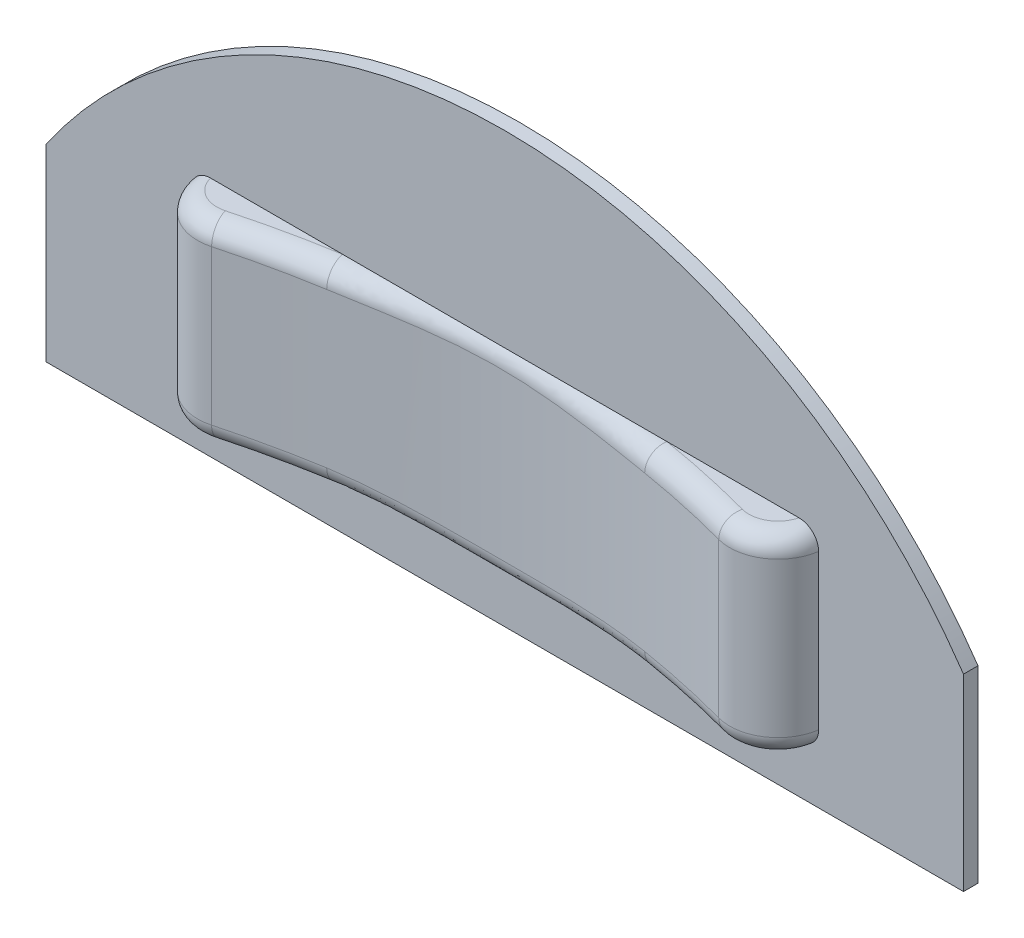
from build123d import *

# Parameters (mm, degrees)
BOSS_EXTRUDE1_DEPTH = 3
SKETCH2_W           = 130
SKETCH2_H           = 40
BOSS_EXTRUDE2_DEPTH = 12
CUT_EXTRUDE1_REACH  = 199.041
FILLET1_R           = 10
FILLET2_R           = 4


with BuildPart() as part:
    # Sketch1 → Boss-Extrude1 (new body)
    with BuildSketch(Plane.XY):
        with BuildLine():
            Line((190, 0), (190, -39))
            Line((190, -39), (0, -39))
            Line((0, -39), (0, 0))
            ThreePointArc((0, 0), (95, 50), (190, 0))
        make_face()
    extrude(amount=BOSS_EXTRUDE1_DEPTH)

    # Sketch2 → Boss-Extrude2 (add)
    with BuildSketch(Plane.XY.offset(3)):
        with Locations((95, -9)):
            Rectangle(SKETCH2_W, SKETCH2_H)
    extrude(amount=BOSS_EXTRUDE2_DEPTH)

    # Sketch3 → Cut-Extrude1 (cut, up to next)
    with BuildSketch(Plane(origin=(0, 11, 0), x_dir=(1, 0, 0), z_dir=(0, 1, 0)), mode=Mode.PRIVATE) as cut_extrude1_sk1:
        with BuildLine():
            Line((30, -15), (160, -15))
            ThreePointArc((160, -15), (95, -4.241357564), (30, -15))
        make_face()
    cut_extrude1_tool1 = extrude(cut_extrude1_sk1.sketch, amount=-CUT_EXTRUDE1_REACH, mode=Mode.PRIVATE) & part.part
    add(cut_extrude1_tool1.solids().sort_by_distance((95, 11, 10.686553))[0], mode=Mode.SUBTRACT)

    # Fillet1
    # the kernel refuses this fillet: 10 mm, written as the material it takes off along each edge
    with BuildSketch(Plane(origin=(160, 43.655354589, 15), x_dir=(0, 0, -1), z_dir=(0, -1, 0)), Plane(origin=(30, -61.655354589, 15), x_dir=(0, 0, -1), z_dir=(0, 1, 0))) as fillet1_piece_1:
        with BuildLine():
            CenterArc((13.461551545, -9.892616796), FILLET1_R, 98.40417735, 96.681797386)
            Line((3.806187845, -12.495298453), (3.613080571, -12.547352086))
            ThreePointArc((3.613080571, -12.547352086), (1.812932851, -6.275113154), (-0.189333785, -0.064441584))
            Line((-0.189333785, -0.064441584), (0, 0.2))
            ThreePointArc((0, 0.2), (6, 0.2), (11.970768969, 0.197852336))
            Line((11.970768969, 0.197852336), (12, 0))
        make_face()
    extrude(amount=105.310709179, mode=Mode.SUBTRACT)

    # Fillet2
    fillet2_edges = [part.edges().sort_by_distance(p)[0] for p in [
        (95, -29, 4.241357564),
        (95, 11, 4.241357564),
        (34.408965823, 11, 9.900838783),
        (155.591034177, 11, 9.900838783),
        (34.408965823, -29, 9.900838783),
        (155.591034177, -29, 9.900838783),
    ]]
    fillet(fillet2_edges, radius=FILLET2_R)


solid = part.part
